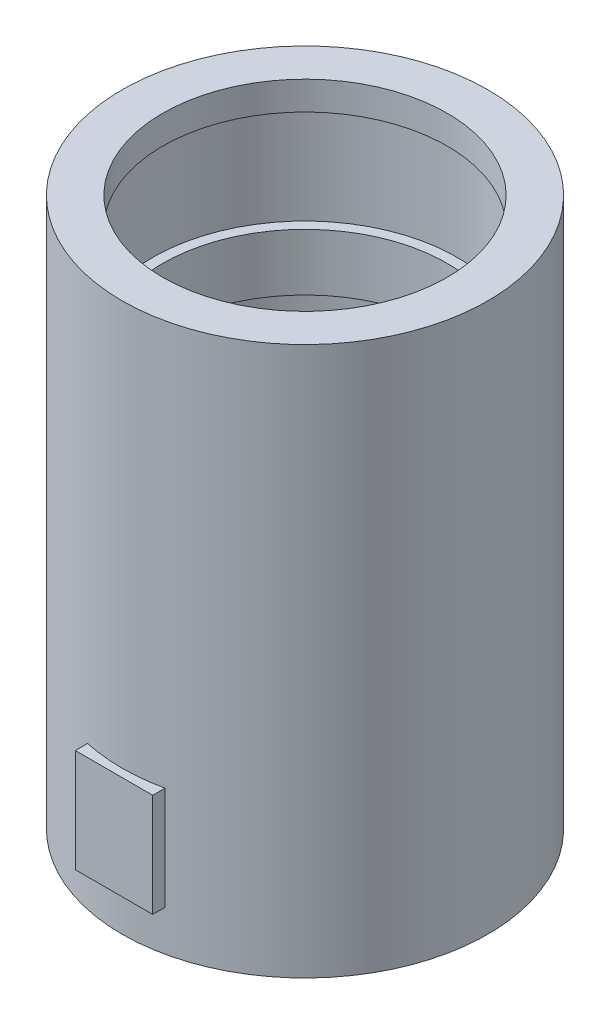
from build123d import *

# Parameters (mm, degrees)
SKETCH1_R                = 45
BOSS_EXTRUDE1_DEPTH      = 135
SKETCH2_R                = 35
CUT_EXTRUDE1_DEPTH       = 90
SKETCH3_R                = 37.5
SKETCH3_R_2              = 35
CUT_EXTRUDE2_DEPTH       = 25
SKETCH4_R                = 37.5
SKETCH4_R_2              = 35
CUT_EXTRUDE3_DEPTH       = 25
SKETCH5_R                = 7.5
CUT_EXTRUDE4_DEPTH       = 5
BOSS_EXTRUDE2_DEPTH      = 2
BOSS_EXTRUDE2_DEPTH_BACK = 4
SKETCH6_W                = 19.05
SKETCH6_H                = 25.4


with BuildPart() as part:
    # Sketch1 → Boss-Extrude1 (new body)
    with BuildSketch(Plane(origin=(0, 0, 0), x_dir=(1, 0, 0), z_dir=(0, 1, 0))):
        Circle(SKETCH1_R)
    extrude(amount=BOSS_EXTRUDE1_DEPTH)

    # Sketch2 → Cut-Extrude1 (cut)
    with BuildSketch(Plane(origin=(0, 135, 0), x_dir=(1, 0, 0), z_dir=(0, 1, 0))):
        Circle(SKETCH2_R)
    extrude(amount=-CUT_EXTRUDE1_DEPTH, mode=Mode.SUBTRACT)

    # Sketch3 → Cut-Extrude2 (cut)
    with BuildSketch(Plane(origin=(0, 128, 0), x_dir=(1, 0, 0), z_dir=(0, 1, 0))):
        Circle(SKETCH3_R)
        Circle(SKETCH3_R_2, mode=Mode.SUBTRACT)
    extrude(amount=-CUT_EXTRUDE2_DEPTH, mode=Mode.SUBTRACT)

    # Sketch4 → Cut-Extrude3 (cut)
    with BuildSketch(Plane(origin=(0, 89, 0), x_dir=(1, 0, 0), z_dir=(0, 1, 0))):
        Circle(SKETCH4_R)
        Circle(SKETCH4_R_2, mode=Mode.SUBTRACT)
    extrude(amount=-CUT_EXTRUDE3_DEPTH, mode=Mode.SUBTRACT)

    # Sketch5 → Cut-Extrude4 (cut)
    with BuildSketch(Plane(origin=(0, 45, 0), x_dir=(1, 0, 0), z_dir=(0, 1, 0))):
        Circle(SKETCH5_R)
    extrude(amount=-CUT_EXTRUDE4_DEPTH, mode=Mode.SUBTRACT)

    # Sketch6 → Boss-Extrude2 (add, two sides: drawn at the far end of the back side and taken through both)
    with BuildSketch(Plane.XY.offset(45).offset(-BOSS_EXTRUDE2_DEPTH_BACK)):
        with Locations((0, 22.7)):
            Rectangle(SKETCH6_W, SKETCH6_H)
    extrude(amount=BOSS_EXTRUDE2_DEPTH + BOSS_EXTRUDE2_DEPTH_BACK)


solid = part.part
